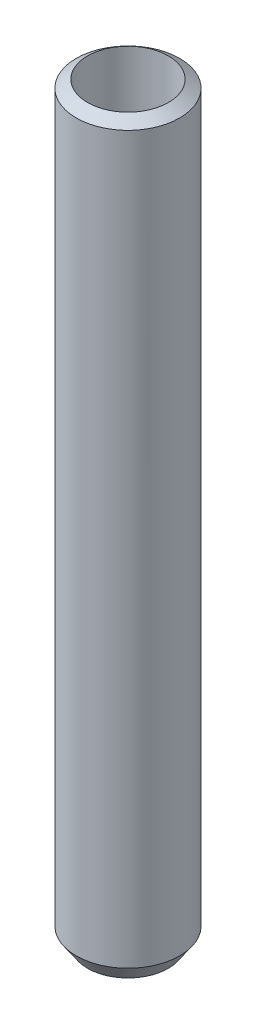
from build123d import *

# Parameters (mm, degrees)
SKETCH1_R           = 25
BOSS_EXTRUDE1_DEPTH = 364.692686
SKETCH2_R           = 19.544034105
CUT_EXTRUDE1_DEPTH  = 367.402449803


with BuildPart() as part:
    # Sketch1 → Boss-Extrude1 (new body)
    with BuildSketch(Plane(origin=(0, 0, 0), x_dir=(1, 0, 0), z_dir=(0, 1, 0))):
        with Locations(Location((0, 0, 0), (0, 0, 270))):
            Circle(SKETCH1_R)
    extrude(amount=BOSS_EXTRUDE1_DEPTH)

    # Sketch2 → Cut-Extrude1 (cut, through all)
    with BuildSketch(Plane(origin=(0, 0, 0), x_dir=(1, 0, 0), z_dir=(0, 1, 0))):
        with Locations(Location((0, 0, 0), (0, 0, 270))):
            Circle(SKETCH2_R)
    extrude(amount=CUT_EXTRUDE1_DEPTH, mode=Mode.SUBTRACT)

    # Chamfer1: read off the stored shape, not the designer's step
    # Chamfer1 outline → Chamfer1 (revolve, cut)
    with BuildSketch(Plane.XY):
        Polygon((25, 359.08197147), (25, 364.692686108), (19.544034105, 364.692686108), (19.544034105, 362.822599982), align=None)
        Polygon((25, 8.183616101), (19.544034105, 0.225711764), (19.544034105, 0), (25, 0), align=None)
    revolve(axis=Axis((0, 0, 0), (0, 1, 0)), mode=Mode.SUBTRACT)


solid = part.part
